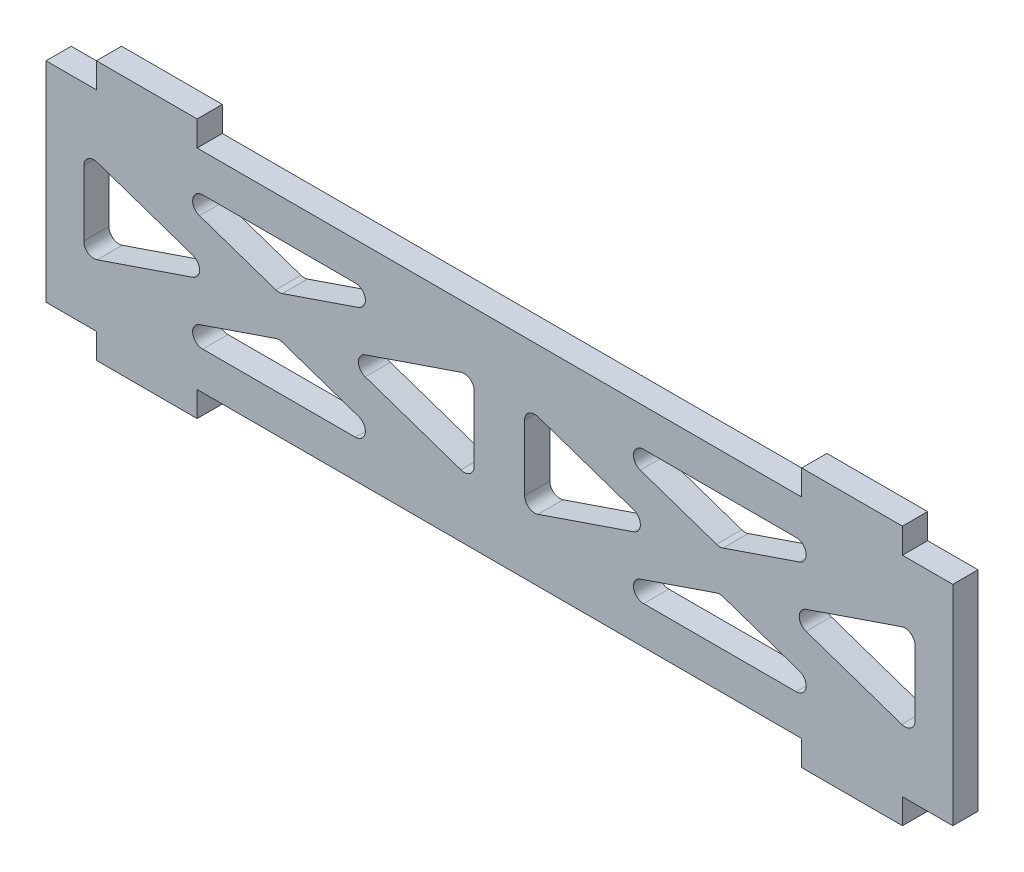
from build123d import *

# Parameters (mm, degrees)
BOSS_EXTRUDE1_DEPTH = 6.35
CUT_EXTRUDE1_DEPTH  = 237.19387672
FILLET1_R           = 2.54


with BuildPart() as part:
    # Sketch1 → Boss-Extrude1 (new body)
    with BuildSketch(Plane.XY):
        Polygon((0, 0), (12.7, 0), (12.7, -6.35), (38.1, -6.35), (38.1, 0), (190.5, 0), (190.5, -6.35), (215.9, -6.35), (215.9, 0), (228.6, 0), (228.6, 52.72), (215.9, 52.72), (215.9, 59.07), (190.5, 59.07), (190.5, 52.72), (38.1, 52.72), (38.1, 59.07), (12.7, 59.07), (12.7, 52.72), (0, 52.72), align=None)
    extrude(amount=BOSS_EXTRUDE1_DEPTH)

    # Sketch2 → Cut-Extrude1 (cut, through all)
    with BuildSketch(Plane.XY.offset(6.35)):
        Polygon((93.236073871, 43.195), (24.238926129, 43.195), (58.7375, 31.393455857), align=None)
        Polygon((44.023573871, 26.36), (9.525, 38.161544143), (9.525, 14.558455857), align=None)
        Polygon((107.95, 38.161544143), (73.451426129, 26.36), (107.95, 14.558455857), align=None)
        Polygon((93.236073871, 9.525), (58.7375, 21.326544143), (24.238926129, 9.525), align=None)
        Polygon((204.361073871, 43.195), (135.363926129, 43.195), (169.8625, 31.393455857), align=None)
        Polygon((155.148573871, 26.36), (120.65, 38.161544143), (120.65, 14.558455857), align=None)
        Polygon((219.075, 38.161544143), (184.576426129, 26.36), (219.075, 14.558455857), align=None)
        Polygon((204.361073871, 9.525), (169.8625, 21.326544143), (135.363926129, 9.525), align=None)
    extrude(amount=-CUT_EXTRUDE1_DEPTH, mode=Mode.SUBTRACT)

    # Fillet1
    fillet1_edges = [part.edges().sort_by_distance(p)[0] for p in [
        (120.65, 14.558455857, 3.175),
        (120.65, 38.161544143, 3.175),
        (155.148573871, 26.36, 3.175),
        (107.95, 38.161544143, 3.175),
        (107.95, 14.558455857, 3.175),
        (73.451426129, 26.36, 3.175),
        (169.8625, 21.326544143, 3.175),
        (204.361073871, 9.525, 3.175),
        (135.363926129, 9.525, 3.175),
        (184.576426129, 26.36, 3.175),
        (219.075, 38.161544143, 3.175),
        (219.075, 14.558455857, 3.175),
        (44.023573871, 26.36, 3.175),
        (9.525, 14.558455857, 3.175),
        (9.525, 38.161544143, 3.175),
        (135.363926129, 43.195, 3.175),
        (204.361073871, 43.195, 3.175),
        (169.8625, 31.393455857, 3.175),
        (93.236073871, 43.195, 3.175),
        (24.238926129, 43.195, 3.175),
        (58.7375, 21.326544143, 3.175),
        (93.236073871, 9.525, 3.175),
        (24.238926129, 9.525, 3.175),
        (58.7375, 31.393455857, 3.175),
    ]]
    fillet(fillet1_edges, radius=FILLET1_R)


solid = part.part
